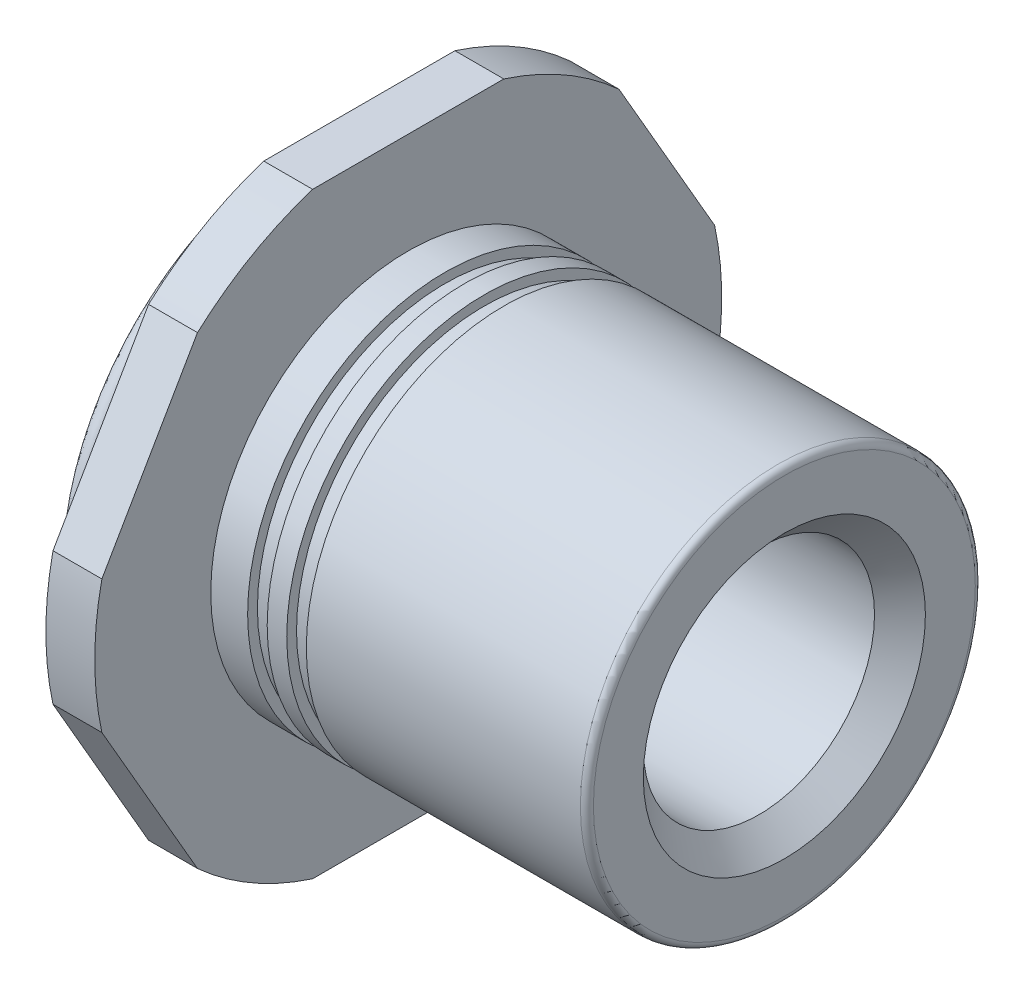
from build123d import *

# Parameters (mm, degrees)
BOSS_EXTRUDE1_DEPTH  = 0.52
M2_CLEARANCE_HOLE1_D = 2.459
CHAMFER1_SIZE        = 0.2705
FILLET1_R            = 0.069333333


with BuildPart() as part:
    # Sketch1 → Boss-Extrude1 (new body)
    with BuildSketch(Plane(origin=(-0.52, 0, 0), x_dir=(0, -1, 0), z_dir=(-1, 0, 0))):
        with BuildLine():
            Line((-3.175, 1.016495973), (-3.175, -1.016495973))
            ThreePointArc((-3.175, -1.016495973), (-2.88711219, -1.666875), (-2.467811335, -2.241382671))
            Line((-2.467811335, -2.241382671), (-0.707188665, -3.257878643))
            ThreePointArc((-0.707188665, -3.257878643), (0, -3.33375), (0.707188665, -3.257878643))
            Line((0.707188665, -3.257878643), (2.467811335, -2.241382671))
            ThreePointArc((2.467811335, -2.241382671), (2.88711219, -1.666875), (3.175, -1.016495973))
            Line((3.175, -1.016495973), (3.175, 1.016495973))
            ThreePointArc((3.175, 1.016495973), (2.88711219, 1.666875), (2.467811335, 2.241382671))
            Line((2.467811335, 2.241382671), (0.707188665, 3.257878643))
            ThreePointArc((0.707188665, 3.257878643), (0, 3.33375), (-0.707188665, 3.257878643))
            Line((-0.707188665, 3.257878643), (-2.467811335, 2.241382671))
            ThreePointArc((-2.467811335, 2.241382671), (-2.88711219, 1.666875), (-3.175, 1.016495973))
        make_face()
    extrude(amount=-BOSS_EXTRUDE1_DEPTH)

    # Sketch2 → Revolve1 (revolve)
    with BuildSketch(Plane(origin=(0, 0, 0), x_dir=(-1, 0, 0), z_dir=(0, 0, -1))):
        with BuildLine():
            Line((0.52, 2.495411544), (0.52, 0))
            Line((0.52, 0), (1.04, 0))
            Line((1.04, 0), (1.04, 2.591))
            add(Edge.make_bspline(
                [(0.862460895, 2.664539105), (0.87069167, 2.672769881), (0.880457009, 2.679693108), (0.890948238, 2.684735472), (0.901439467, 2.689777836), (0.912945949, 2.693078411), (0.924514825, 2.694363876), (0.936083702, 2.69564934), (0.948034058, 2.694955148), (0.959376279, 2.692338786), (0.9707185, 2.689722424), (0.981765419, 2.68511173), (0.991602235, 2.678888517), (1.001439051, 2.672665304), (1.010337076, 2.664657929), (1.017559461, 2.655529485), (1.024781845, 2.646401041), (1.030527791, 2.635899755), (1.034321475, 2.624895242), (1.038055125, 2.614064874), (1.04, 2.602455872), (1.04, 2.591)],
                knots=[0, 0, 0, 0, 3.492e-05, 3.492e-05, 3.492e-05, 6.984e-05, 6.984e-05, 6.984e-05, 0.000104761, 0.000104761, 0.000104761, 0.000139681, 0.000139681, 0.000139681, 0.000174601, 0.000174601, 0.000174601, 0.000209521, 0.000209521, 0.000209521, 0.000243873, 0.000243873, 0.000243873, 0.000243873], degree=3))
            Line((0.862460895, 2.664539105), (0.693333333, 2.495411544))
            Line((0.693333333, 2.495411544), (0.52, 2.495411544))
        make_face()
    revolve(axis=Axis((-0.52, 0, 0), (-1, 0, 0)))

    # Sketch3 → Revolve2 (revolve)
    with BuildSketch(Plane(origin=(0, 0, 0), x_dir=(-1, 0, 0), z_dir=(0, 0, -1))):
        Polygon((-4, 2.1), (-4, 0), (0, 0), (0, 2.1), (-0.392, 2.1), (-0.392, 1.996), (-0.6, 1.996), (-0.6, 2.1), (-0.808, 2.1), (-0.808, 1.996), (-1.016, 1.996), (-1.016, 2.1), align=None)
    revolve(axis=Axis((4, 0, 0), (-1, 0, 0)))

    # M2 Clearance Hole1 (through all)
    with Locations(Plane.ZY.offset(1.04)):
        with Locations((0, 0)):
            Hole(M2_CLEARANCE_HOLE1_D / 2)

    # Chamfer1
    chamfer1_edges = [part.edges().sort_by_distance(p)[0] for p in [
        (4, 0, 1.2295),
        (-1.04, 0, 1.2295),
    ]]
    chamfer(chamfer1_edges, length=CHAMFER1_SIZE)

    # Fillet1
    fillet1_edges = [part.edges().sort_by_distance(p)[0] for p in [
        (4, -2.1, 0),
    ]]
    fillet(fillet1_edges, radius=FILLET1_R)


solid = part.part
